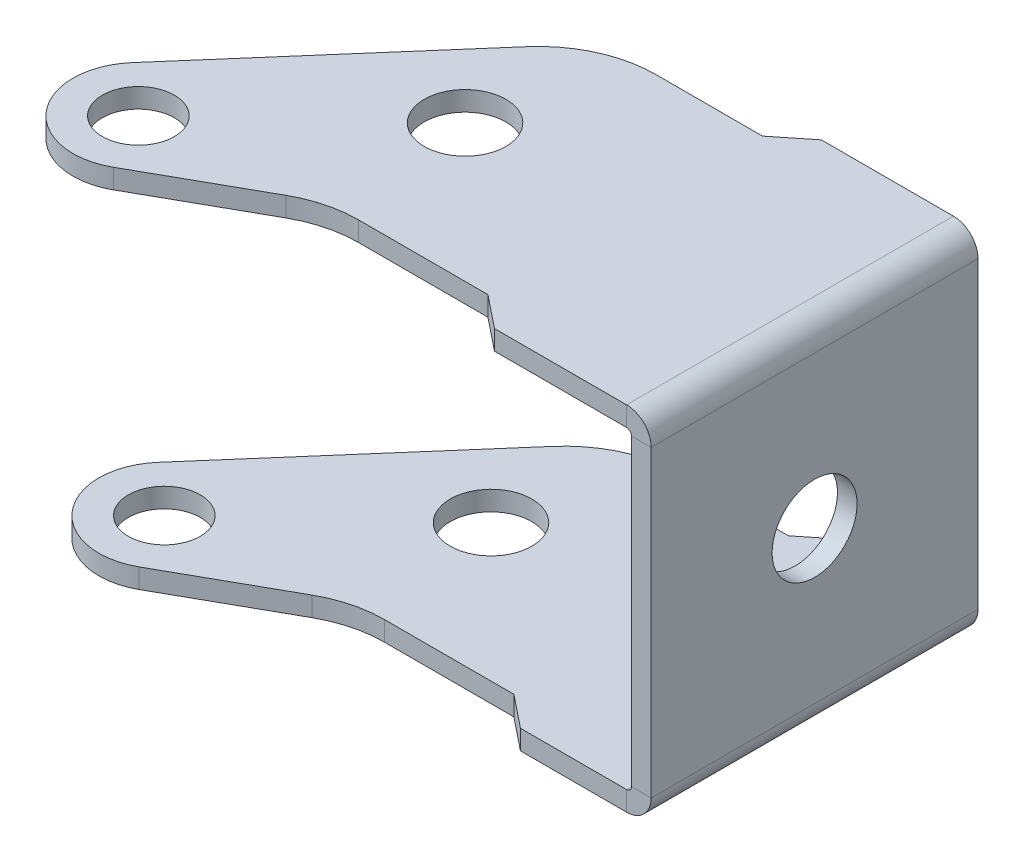
from build123d import *

# Parameters (mm, degrees)
SKETCH1_R                    = 5.5
SKETCH1_R_2                  = 6.25
BASE_FLANGE1_DEPTH           = 3
SKETCHED_START               = -3
SKETCHED_BEND1_OUTLINE_R     = 5.5
SKETCHED_BEND1_OUTLINE_R_2   = 6.25
SKETCHED_BEND1_DEPTH         = 3
SKETCHED_START_2             = 0.762
SKETCHED_BEND1_2_OUTLINE_W   = 3
SKETCHED_BEND1_2_OUTLINE_H   = 50
SKETCHED_BEND1_2_DEPTH       = 46.446858709
SKETCHED_START_3             = 47.208858709
SKETCHED_BEND1_3_OUTLINE_R   = 5.5
SKETCHED_BEND1_3_OUTLINE_R_2 = 6.25
SKETCHED_BEND1_3_DEPTH       = 3.762
SKETCHED_BEND1_4_OUTLINE_R   = 5.5
SKETCHED_BEND1_4_OUTLINE_R_2 = 6.25
SKETCHED_BEND1_4_DEPTH       = 0.762
SKETCHED_START_4             = -26
SKETCHED_BEND1_5_DEPTH       = 61
FILLET1_R                    = 18
SKETCH7_R                    = 6.5
CUT_EXTRUDE1_DEPTH           = 10


with BuildPart() as part:
    # Base-Flange1: sheet metal written as solids
    # Sketch1 → Base-Flange1 (new body)
    with BuildSketch(Plane(origin=(0, 0, 0), x_dir=(1, 0, 0), z_dir=(0, 1, 0))):
        with BuildLine():
            Line((45, 25), (-45, 25))
            Line((-45, 25), (-50, 21))
            Line((-50, 21), (-74.5, 21))
            Line((-74.5, 21), (-107.967539406, -17.5))
            ThreePointArc((-107.967539406, -17.5), (-108.177491125, -30.371550102), (-95.532395294, -32.784521956))
            Line((-95.532395294, -32.784521956), (-74.5, -21))
            Line((-74.5, -21), (-50, -21))
            Line((-50, -21), (-45, -25))
            Line((-45, -25), (45, -25))
            Line((45, -25), (50, -21))
            Line((50, -21), (74.5, -21))
            Line((74.5, -21), (95.532395294, -32.784521956))
            ThreePointArc((95.532395294, -32.784521956), (108.177491125, -30.371550102), (107.967539406, -17.5))
            Line((107.967539406, -17.5), (74.5, 21))
            Line((74.5, 21), (50, 21))
            Line((50, 21), (45, 25))
        make_face()
        with Locations(Location((-100.420443604, -24.06059029, 0), (0, 0, 270))):
            Circle(SKETCH1_R, mode=Mode.SUBTRACT)
        with Locations(Location((-74.5, 0, 0), (0, 0, 270))):
            Circle(SKETCH1_R_2, mode=Mode.SUBTRACT)
        with Locations(Location((74.5, 0, 0), (0, 0, 90))):
            Circle(SKETCH1_R_2, mode=Mode.SUBTRACT)
        with Locations(Location((100.420443604, -24.06059029, 0), (0, 0, 90))):
            Circle(SKETCH1_R, mode=Mode.SUBTRACT)
    extrude(amount=-BASE_FLANGE1_DEPTH)

    # Sketched Bend1: read off the stored shape, not the designer's step
    # Sketched Bend1 outline → Sketched Bend1 (cut)
    with BuildSketch(Plane(origin=(0, 0, 0), x_dir=(1, 0, 0), z_dir=(0, 1, 0)).offset(SKETCHED_START)):
        with BuildLine():
            Line((45, 25), (-25, 25))
            Line((-25, 25), (-25, -25))
            Line((-25, -25), (45, -25))
            Line((45, -25), (50, -21))
            Line((50, -21), (74.5, -21))
            Line((74.5, -21), (95.532395294, -32.784521956))
            ThreePointArc((95.532395294, -32.784521956), (108.177491125, -30.371550102), (107.967539406, -17.5))
            Line((107.967539406, -17.5), (74.5, 21))
            Line((74.5, 21), (50, 21))
            Line((50, 21), (45, 25))
        make_face()
        with Locations((100.420443604, -24.06059029)):
            Circle(SKETCHED_BEND1_OUTLINE_R, mode=Mode.SUBTRACT)
        with Locations((74.5, 0)):
            Circle(SKETCHED_BEND1_OUTLINE_R_2, mode=Mode.SUBTRACT)
    extrude(amount=SKETCHED_BEND1_DEPTH, mode=Mode.SUBTRACT)



with BuildPart() as body_2:
    # Sketched Bend1 2 outline → Sketched Bend1 2 (new body)
    with BuildSketch(Plane(origin=(0, 0, 0), x_dir=(1, 0, 0), z_dir=(0, 1, 0)).offset(SKETCHED_START_2)):
        with Locations((-26.5, 0)):
            Rectangle(SKETCHED_BEND1_2_OUTLINE_W, SKETCHED_BEND1_2_OUTLINE_H)
    extrude(amount=SKETCHED_BEND1_2_DEPTH)

    # Sketched Bend1 3 outline → Sketched Bend1 3 (add)
    with BuildSketch(Plane(origin=(0, 0, 0), x_dir=(1, 0, 0), z_dir=(0, 1, 0)).offset(SKETCHED_START_3)):
        with BuildLine():
            Line((-25, -25), (-25, 25))
            Line((-25, 25), (-48.970858709, 25))
            Line((-48.970858709, 25), (-53.970858709, 21))
            Line((-53.970858709, 21), (-78.470858709, 21))
            Line((-78.470858709, 21), (-111.938398115, -17.5))
            ThreePointArc((-111.938398115, -17.5), (-112.148349834, -30.371550102), (-99.503254003, -32.784521956))
            Line((-99.503254003, -32.784521956), (-78.470858709, -21))
            Line((-78.470858709, -21), (-53.970858709, -21))
            Line((-53.970858709, -21), (-48.970858709, -25))
            Line((-48.970858709, -25), (-25, -25))
        make_face()
        with Locations((-104.391302312, -24.06059029)):
            Circle(SKETCHED_BEND1_3_OUTLINE_R, mode=Mode.SUBTRACT)
        with Locations((-78.470858709, 0)):
            Circle(SKETCHED_BEND1_3_OUTLINE_R_2, mode=Mode.SUBTRACT)
    extrude(amount=SKETCHED_BEND1_3_DEPTH)


with BuildPart() as part_1:
    add(part.part)

    add(body_2.part)  # Sketched Bend1 4 merges body 2
    # Sketched Bend1 4 outline → Sketched Bend1 4 (add)
    with BuildSketch(Plane(origin=(0, 0, 0), x_dir=(1, 0, 0), z_dir=(0, 1, 0))):
        with BuildLine():
            Line((-25, -25), (-25, 25))
            Line((-25, 25), (-48.970858709, 25))
            Line((-48.970858709, 25), (-53.970858709, 21))
            Line((-53.970858709, 21), (-78.470858709, 21))
            Line((-78.470858709, 21), (-111.938398115, -17.5))
            ThreePointArc((-111.938398115, -17.5), (-112.148349834, -30.371550102), (-99.503254003, -32.784521956))
            Line((-99.503254003, -32.784521956), (-78.470858709, -21))
            Line((-78.470858709, -21), (-53.970858709, -21))
            Line((-53.970858709, -21), (-48.970858709, -25))
            Line((-48.970858709, -25), (-25, -25))
        make_face()
        with Locations((-104.391302312, -24.06059029)):
            Circle(SKETCHED_BEND1_4_OUTLINE_R, mode=Mode.SUBTRACT)
        with Locations((-78.470858709, 0)):
            Circle(SKETCHED_BEND1_4_OUTLINE_R_2, mode=Mode.SUBTRACT)
    extrude(amount=SKETCHED_BEND1_4_DEPTH)

    # Sketched Bend1 5 outline → Sketched Bend1 5 (cut)
    with BuildSketch(Plane.XY.offset(SKETCHED_START_4)):
        with BuildLine():
            ThreePointArc((-28.762, 50.970858709), (-26.101864289, 49.86899442), (-25, 47.208858709))
            Line((-25, 47.208858709), (-25.000000008, 52))
            Line((-25.000000008, 52), (-116, 52))
            Line((-116, 52), (-116, 50.970858695))
            Line((-116, 50.970858695), (-28.762, 50.970858709))
        make_face()
        with BuildLine():
            ThreePointArc((-25, 0.762), (-26.101864289, -1.898135711), (-28.762, -3))
            Line((-28.762, -3), (-116, -2.999999986))
            Line((-116, -2.999999986), (-116, -4))
            Line((-116, -4), (-25.000000008, -4))
            Line((-25.000000008, -4), (-25, 0.762))
        make_face()
        with BuildLine():
            Line((-28.762, 47.970858709), (-116, 47.970858709))
            Line((-116, 47.970858709), (-116, 47.208858709))
            Line((-116, 47.208858709), (-28, 47.208858709))
            ThreePointArc((-28, 47.208858709), (-28.223184633, 47.747674076), (-28.762, 47.970858709))
        make_face()
        with BuildLine():
            Line((-116, 0), (-28.762, 0))
            ThreePointArc((-28.762, 0), (-28.223184633, 0.223184633), (-28, 0.762))
            Line((-28, 0.762), (-116, 0.762))
            Line((-116, 0.762), (-116, 0))
        make_face()
    extrude(amount=SKETCHED_BEND1_5_DEPTH, mode=Mode.SUBTRACT)

    # Fillet1
    fillet1_edges = [part_1.edges().sort_by_distance(p)[0] for p in [
        (-78.470858709, 49.470858709, 21),
        (-78.470858709, 49.470858709, -21),
        (-74.5, -1.5, -21),
        (-74.5, -1.5, 21),
    ]]
    fillet(fillet1_edges, radius=FILLET1_R)

    # Sketch7 → Cut-Extrude1 (cut)
    with BuildSketch(Plane(origin=(-25, 0, 0), x_dir=(0, 0, -1), z_dir=(1, 0, 0))):
        with Locations(Location((0, 23.985429354, 0), (0, 0, 90))):
            Circle(SKETCH7_R)
    extrude(amount=-CUT_EXTRUDE1_DEPTH, mode=Mode.SUBTRACT)


solid = part_1.part
